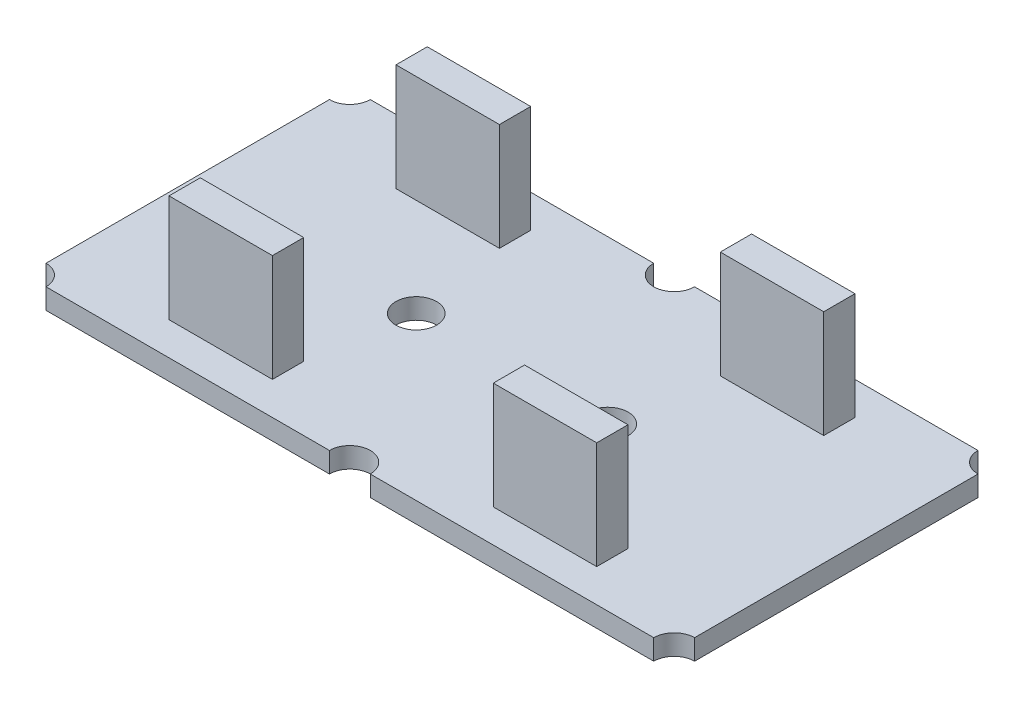
from build123d import *

# Parameters (mm, degrees)
EXTRUDE_1_DEPTH          = 1.6
SKETCH_2_W               = 8.1
SKETCH_2_H               = 2.45
EXTRUDE_2_DEPTH          = 8.4
MIRROR_2_COPY_1_SKETCH_W = 8.1
MIRROR_2_COPY_1_SKETCH_H = 2.45
MIRROR_2_COPY_1_DEPTH    = 8.4
SKETCH_3_R               = 1.6
CUT_EXTRUDE_1_DEPTH      = 30.614354627


with BuildPart() as part:
    # Эскиз1 → Бобышка-Вытянуть1 (new body)
    with BuildSketch(Plane(origin=(0, 0, 0), x_dir=(1, 0, 0), z_dir=(0, 1, 0))):
        with BuildLine():
            ThreePointArc((23.8, -12.7), (24.26862915, -11.56862915), (25.4, -11.1))
            Line((25.4, -11.1), (25.4, 11.1))
            ThreePointArc((25.4, 11.1), (24.26862915, 11.56862915), (23.8, 12.7))
            Line((23.8, 12.7), (1.6, 12.7))
            ThreePointArc((1.6, 12.7), (0, 11.1), (-1.6, 12.7))
            Line((-1.6, 12.7), (-23.8, 12.7))
            ThreePointArc((-23.8, 12.7), (-24.26862915, 11.56862915), (-25.4, 11.1))
            Line((-25.4, 11.1), (-25.4, -11.1))
            ThreePointArc((-25.4, -11.1), (-24.26862915, -11.56862915), (-23.8, -12.7))
            Line((-23.8, -12.7), (-1.6, -12.7))
            ThreePointArc((-1.6, -12.7), (0, -11.1), (1.6, -12.7))
            Line((1.6, -12.7), (23.8, -12.7))
        make_face()
    extrude(amount=-EXTRUDE_1_DEPTH)

    # Эскиз2 → Бобышка-Вытянуть2 (add)
    with BuildSketch(Plane(origin=(0, 0, 0), x_dir=(1, 0, 0), z_dir=(0, 1, 0))):
        with Locations((-12.7, 8.89)):
            Rectangle(SKETCH_2_W, SKETCH_2_H)
    extrude_2 = extrude(amount=EXTRUDE_2_DEPTH)

    # Зеркальное отражение1: Бобышка-Вытянуть2 across plane
    add(extrude_2.mirror(Plane.XY))

    # Зеркальное отражение2: Бобышка-Вытянуть2 across plane
    add(extrude_2.mirror(Plane(origin=(0, 0, 0), x_dir=(0, 0, 1), z_dir=(1, 0, 0))))

    # Зеркальное отражение2 copy 1 sketch → Зеркальное отражение2 copy 1 (add)
    with BuildSketch(Plane(origin=(0, 0, 0), x_dir=(-1, 0, 0), z_dir=(0, 1, 0))):
        with Locations((-12.7, 8.89)):
            Rectangle(MIRROR_2_COPY_1_SKETCH_W, MIRROR_2_COPY_1_SKETCH_H)
    extrude(amount=MIRROR_2_COPY_1_DEPTH)

    # Эскиз3 → Вырез-Вытянуть1 (cut, through all)
    with BuildSketch(Plane(origin=(0, 0, 0), x_dir=(1, 0, 0), z_dir=(0, 1, 0))):
        with Locations((-7.5, 0)):
            Circle(SKETCH_3_R)
        with Locations((7.5, 0)):
            Circle(SKETCH_3_R)
    extrude(amount=-CUT_EXTRUDE_1_DEPTH, mode=Mode.SUBTRACT)


solid = part.part
